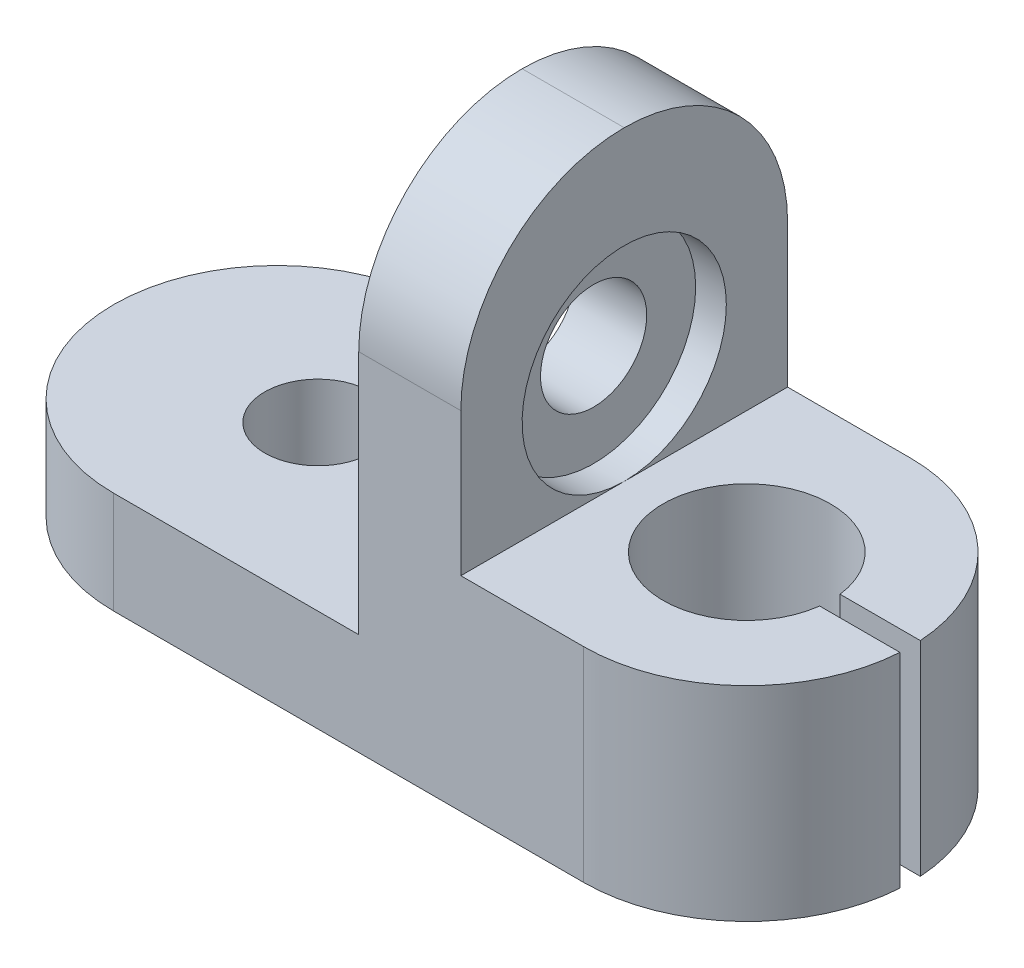
from build123d import *

# Parameters (mm, degrees)
SKETCH1_R           = 2.6
BOSS_EXTRUDE2_DEPTH = 5
BOSS_EXTRUDE3_DEPTH = 10
SKETCH1_5_W         = 5
SKETCH1_5_H         = 16
BOSS_EXTRUDE4_DEPTH = 25
FILLET1_R           = 8
FILLET2_R           = 8
FILLET3_R           = 8
FILLET4_R           = 8
FILLET5_R           = 8
FILLET6_R           = 8
SKETCH3_R           = 2.6
CUT_EXTRUDE1_DEPTH  = 25
SKETCH4_R           = 5
CUT_EXTRUDE2_DEPTH  = 1.5


# Some blends are built 0.0001 mm under size
with BuildPart() as part:
    # Sketch1 → Boss-Extrude2 (new body)
    with BuildSketch(Plane(origin=(0, 0, 0), x_dir=(1, 0, 0), z_dir=(0, 1, 0))):
        with BuildLine():
            Line((-25, 8), (-25, -8))
            Line((-25, -8), (14, -8))
            Line((14, -8), (14, -0.5))
            Line((14, -0.5), (10.06939799, -0.5))
            ThreePointArc((10.06939799, -0.5), (1.9, 0), (10.06939799, 0.5))
            Line((10.06939799, 0.5), (14, 0.5))
            Line((14, 0.5), (14, 8))
            Line((14, 8), (-25, 8))
        make_face()
        with Locations(Location((-15, 0, 0), (0, 0, 270))):
            Circle(SKETCH1_R, mode=Mode.SUBTRACT)
    extrude(amount=BOSS_EXTRUDE2_DEPTH)

    # Sketch1<4> → Boss-Extrude3 (add)
    with BuildSketch(Plane(origin=(0, 0, 0), x_dir=(1, 0, 0), z_dir=(0, 1, 0))):
        with BuildLine():
            Line((14, 8), (0, 8))
            Line((0, 8), (0, -8))
            Line((0, -8), (14, -8))
            Line((14, -8), (14, -0.5))
            Line((14, -0.5), (10.06939799, -0.5))
            ThreePointArc((10.06939799, -0.5), (1.9, 0), (10.06939799, 0.5))
            Line((10.06939799, 0.5), (14, 0.5))
            Line((14, 0.5), (14, 8))
        make_face()
    extrude(amount=BOSS_EXTRUDE3_DEPTH)

    # Sketch1<5> → Boss-Extrude4 (add)
    with BuildSketch(Plane(origin=(0, 0, 0), x_dir=(1, 0, 0), z_dir=(0, 1, 0))):
        with Locations((-2.5, 0)):
            Rectangle(SKETCH1_5_W, SKETCH1_5_H)
    extrude(amount=BOSS_EXTRUDE4_DEPTH)

    # Fillet1
    # the kernel refuses this fillet: 8 mm, written as the material it takes off along each edge
    with BuildSketch(Plane(origin=(14, 29.960899278, 8), x_dir=(0, 0, -1), z_dir=(0, -1, 0))) as fillet1_piece_1:
        with BuildLine():
            CenterArc((8, -7.984359711), FILLET1_R, 93.583321698, 86.416678302)
            Line((0, -7.984359711), (-0.16, -7.984359711))
            Line((-0.16, -7.984359711), (-0.16, 0))
            Line((-0.16, 0), (0, 0.16))
            ThreePointArc((0, 0.16), (3.75, 0.16), (7.49, 0.159687194))
            Line((7.49, 0.159687194), (7.5, 0))
        make_face()
    extrude(amount=49.921798557, mode=Mode.SUBTRACT)

    # Fillet2
    # the kernel refuses this fillet: 8 mm, written as the material it takes off along each edge
    with BuildSketch(Plane(origin=(14, -19.960899278, -8), x_dir=(0, 0, 1), z_dir=(0, 1, 0))) as fillet2_piece_1:
        with BuildLine():
            CenterArc((8, -7.984359711), FILLET2_R, 93.583321698, 86.416678302)
            Line((0, -7.984359711), (-0.16, -7.984359711))
            Line((-0.16, -7.984359711), (-0.16, 0))
            Line((-0.16, 0), (0, 0.16))
            ThreePointArc((0, 0.16), (3.75, 0.16), (7.49, 0.159687194))
            Line((7.49, 0.159687194), (7.5, 0))
        make_face()
    extrude(amount=49.921798557, mode=Mode.SUBTRACT)

    # Fillet3
    fillet3_edges = [part.edges().sort_by_distance(p)[0] for p in [
        (-25, 2.5, 8),
    ]]
    fillet(fillet3_edges, radius=FILLET3_R)

    # Fillet4
    fillet4_edges = [part.edges().sort_by_distance(p)[0] for p in [
        (-25, 2.5, -8),
    ]]
    fillet(fillet4_edges, radius=FILLET4_R - 0.0001)  # a hair under: the kernel refuses the full size

    # Fillet5
    fillet5_edges = [part.edges().sort_by_distance(p)[0] for p in [
        (-2.5, 25, 8),
    ]]
    fillet(fillet5_edges, radius=FILLET5_R)

    # Fillet6
    fillet6_edges = [part.edges().sort_by_distance(p)[0] for p in [
        (-2.5, 25, -8),
    ]]
    fillet(fillet6_edges, radius=FILLET6_R - 0.0001)  # a hair under: the kernel refuses the full size

    # Sketch3 → Cut-Extrude1 (cut)
    with BuildSketch(Plane.ZY.offset(5)):
        with Locations((0, 15)):
            Circle(SKETCH3_R)
    extrude(amount=-CUT_EXTRUDE1_DEPTH, mode=Mode.SUBTRACT)

    # Sketch4 → Cut-Extrude2 (cut)
    with BuildSketch(Plane(origin=(0, 0, 0), x_dir=(0, 0, -1), z_dir=(1, 0, 0))):
        with Locations((0, 15)):
            Circle(SKETCH4_R)
    extrude(amount=-CUT_EXTRUDE2_DEPTH, mode=Mode.SUBTRACT)


solid = part.part
